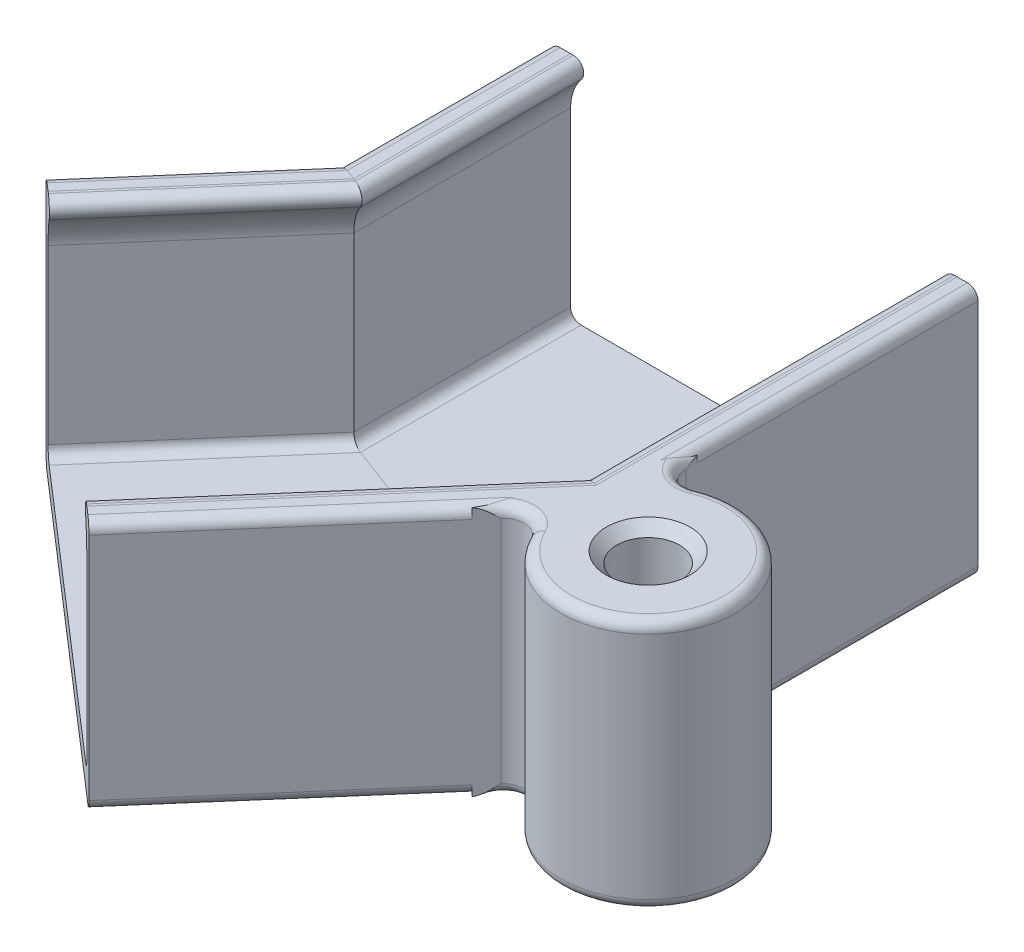
from build123d import *
from OCP.BRepFilletAPI import BRepFilletAPI_MakeChamfer

# Parameters (mm, degrees)
SKETCH4_R           = 3
BOSS_EXTRUDE2_DEPTH = 24
CUT_EXTRUDE2_DEPTH  = 6
CUT_EXTRUDE2_DRAFT  = -2
CHAMFER1_SIZE       = 1
CHAMFER1_SIZE2      = 1.036815955
FILLET2_R           = 1
FILLET3_R           = 1
CHAMFER2_SIZE       = 1


with BuildPart() as part:
    # Sweep1: sweep along a path in Sketch3
    with BuildLine(Plane(origin=(0, 0, 0), x_dir=(1, 0, 0), z_dir=(0, 1, 0))) as sweep1_path:
        Line((0, 0), (0, -27.651449467))
        Line((0, -27.651449467), (-18.11741187, -48.540730085))
    # Sketch1 → Sweep1 (sweep)
    with BuildSketch(Plane.XY):
        with BuildLine():
            Line((-17.5, -12.023018516), (17.5, -12.023018516))
            ThreePointArc((17.5, -12.023018516), (18.207106781, -11.730125297), (18.5, -11.023018516))
            Line((18.5, -11.023018516), (18.5, 5.476981484))
            ThreePointArc((18.5, 5.476981484), (18.235010721, 6.998390104), (17.471251471, 8.340617848))
            ThreePointArc((17.471251471, 8.340617848), (17.338106653, 9.403382917), (18.242640687, 9.976981484))
            Line((18.242640687, 9.976981484), (18.5, 9.976981484))
            Line((18.5, 9.976981484), (19.5, 9.976981484))
            ThreePointArc((19.5, 9.976981484), (20.207106781, 9.684088265), (20.5, 8.976981484))
            Line((20.5, 8.976981484), (20.5, -13.023018516))
            ThreePointArc((20.5, -13.023018516), (20.207106781, -13.730125297), (19.5, -14.023018516))
            Line((19.5, -14.023018516), (-19.5, -14.023018516))
            ThreePointArc((-19.5, -14.023018516), (-20.207106781, -13.730125297), (-20.5, -13.023018516))
            Line((-20.5, -13.023018516), (-20.5, 8.976981484))
            ThreePointArc((-20.5, 8.976981484), (-20.207106781, 9.684088265), (-19.5, 9.976981484))
            Line((-19.5, 9.976981484), (-18.5, 9.976981484))
            Line((-18.5, 9.976981484), (-18.242640687, 9.976981484))
            ThreePointArc((-18.242640687, 9.976981484), (-17.338106653, 9.403382917), (-17.471251471, 8.340617848))
            ThreePointArc((-17.471251471, 8.340617848), (-18.235010721, 6.998390104), (-18.5, 5.476981484))
            Line((-18.5, 5.476981484), (-18.5, -11.023018516))
            ThreePointArc((-18.5, -11.023018516), (-18.207106781, -11.730125297), (-17.5, -12.023018516))
        make_face()
    sweep(path=sweep1_path.line, transition=Transition.RIGHT)

    # Sketch4 → Boss-Extrude2 (add, through all)
    with BuildSketch(Plane(origin=(0, -14.023018516, 0), x_dir=(-1, 0, 0), z_dir=(0, -1, 0))):
        with BuildLine():
            Line((-20.5, -27.966087618), (-20.5, -26.908421005))
            Line((-20.5, -26.908421005), (-19.5, -29.43643253))
            Line((-19.5, -29.43643253), (-19.5, -34.929657496))
            Line((-19.5, -34.929657496), (-15.504976059, -39.535899093))
            Line((-15.504976059, -39.535899093), (-14.394999659, -42.341932225))
            Line((-14.394999659, -42.341932225), (-15.692872888, -40.845491216))
            ThreePointArc((-15.692872888, -40.845491216), (-17.453136797, -40.171510936), (-18.991916583, -41.260058232))
            ThreePointArc((-18.991916583, -41.260058232), (-34.264928426, -40.440540605), (-23.263888778, -29.814458234))
            ThreePointArc((-23.263888778, -29.814458234), (-21.388194612, -29.628582363), (-20.5, -27.966087618))
        make_face()
        with Locations(Location((-26.449921847, -37.523656316, 0), (0, 0, 90))):
            Circle(SKETCH4_R, mode=Mode.SUBTRACT)
    extrude(amount=-BOSS_EXTRUDE2_DEPTH)


with BuildPart() as cut_extrude2_tool:
    # Sketch5 → Cut-Extrude2 (with draft: the straight prism first)
    with BuildSketch(Plane(origin=(0, -14.023018516, 0), x_dir=(-1, 0, 0), z_dir=(0, -1, 0))):
        Polygon((-27.501650461, -43.786818477), (-21.551728614, -41.566061095), (-20.5, -35.302898934), (-25.398193232, -31.260494155), (-31.348115079, -33.481251538), (-32.399843693, -39.744413699), align=None)
    extrude(amount=-CUT_EXTRUDE2_DEPTH)
    # Cut-Extrude2: the draft: its side faces are tilted about the plane it starts from
    cut_extrude2_sides = [cut_extrude2_tool.faces().sort_by_distance(p)[0] for p in [
        (24.526689538, -11.023018516, 42.676439786),
        (21.025864307, -11.023018516, 38.434480014),
        (22.949096616, -11.023018516, 33.281696545),
        (28.373154156, -11.023018516, 32.370872847),
        (31.873979386, -11.023018516, 36.612832618),
        (29.950747077, -11.023018516, 41.765616088),
    ]]
    draft(cut_extrude2_sides, Plane(origin=(0, -14.023018516, 0), x_dir=(-1, 0, 0), z_dir=(0, -1, 0)), CUT_EXTRUDE2_DRAFT)


with BuildPart() as part_1:
    add(part.part)

    # Cut-Extrude2: cut by cut_extrude2_tool
    add(cut_extrude2_tool.part, mode=Mode.SUBTRACT)

    # Chamfer1: one chamfer whose edges measure the first distance from different faces: ONE call of the kernel's chamfer builder (chamfer() names one face for all edges)
    chamfer1_edges_1 = [part_1.edges().sort_by_distance(p)[0] for p in [
        (31.667347826, -8.023018516, 36.647530798),
    ]]
    chamfer1_side_1 = [part_1.faces().sort_by_distance(p)[0] for p in [
        (31.771332319, -11.042436068, 36.630069416),
    ]]
    chamfer1_edges_2 = [part_1.edges().sort_by_distance(p)[0] for p in [
        (28.29988788, -8.023018516, 32.567170116),
    ]]
    chamfer1_side_2 = [part_1.faces().sort_by_distance(p)[0] for p in [
        (28.336758127, -11.042436068, 32.468386213),
    ]]
    chamfer1_edges_3 = [part_1.edges().sort_by_distance(p)[0] for p in [
        (23.082461901, -8.023018516, 33.443295635),
    ]]
    chamfer1_side_3 = [part_1.faces().sort_by_distance(p)[0] for p in [
        (23.015347654, -11.042436068, 33.361973113),
    ]]
    chamfer1_edges_4 = [part_1.edges().sort_by_distance(p)[0] for p in [
        (21.232495867, -8.023018516, 38.399781835),
    ]]
    chamfer1_side_4 = [part_1.faces().sort_by_distance(p)[0] for p in [
        (21.128511374, -11.042436068, 38.417243217),
    ]]
    chamfer1_edges_5 = [part_1.edges().sort_by_distance(p)[0] for p in [
        (24.599955813, -8.023018516, 42.480142516),
    ]]
    chamfer1_side_5 = [part_1.faces().sort_by_distance(p)[0] for p in [
        (24.563085567, -11.042436068, 42.57892642),
    ]]
    chamfer1_edges_6 = [part_1.edges().sort_by_distance(p)[0] for p in [
        (29.817381793, -8.023018516, 41.604016998),
    ]]
    chamfer1_side_6 = [part_1.faces().sort_by_distance(p)[0] for p in [
        (29.884496039, -11.042436068, 41.685339519),
    ]]
    chamfer1 = BRepFilletAPI_MakeChamfer(part_1.part.solid().wrapped)
    for e in chamfer1_edges_1:
        chamfer1.Add(CHAMFER1_SIZE, CHAMFER1_SIZE2, e.wrapped, chamfer1_side_1[0].wrapped)  # the first distance lies on this face
    for e in chamfer1_edges_2:
        chamfer1.Add(CHAMFER1_SIZE, CHAMFER1_SIZE2, e.wrapped, chamfer1_side_2[0].wrapped)  # the first distance lies on this face
    for e in chamfer1_edges_3:
        chamfer1.Add(CHAMFER1_SIZE, CHAMFER1_SIZE2, e.wrapped, chamfer1_side_3[0].wrapped)  # the first distance lies on this face
    for e in chamfer1_edges_4:
        chamfer1.Add(CHAMFER1_SIZE, CHAMFER1_SIZE2, e.wrapped, chamfer1_side_4[0].wrapped)  # the first distance lies on this face
    for e in chamfer1_edges_5:
        chamfer1.Add(CHAMFER1_SIZE, CHAMFER1_SIZE2, e.wrapped, chamfer1_side_5[0].wrapped)  # the first distance lies on this face
    for e in chamfer1_edges_6:
        chamfer1.Add(CHAMFER1_SIZE, CHAMFER1_SIZE2, e.wrapped, chamfer1_side_6[0].wrapped)  # the first distance lies on this face
    add(Compound.cast(chamfer1.Shape()), mode=Mode.REPLACE)

    # Fillet2
    # the kernel refuses this fillet: 1 mm, written as the material it takes off along each edge
    with BuildSketch(Plane(origin=(22.5, 9.976981484, 27.966087618), x_dir=(0.3819443891792231, 0, 0.9241853080278383), z_dir=(0.9241853080278383, 0, -0.3819443891792231))) as fillet2_piece_1:
        with BuildLine():
            CenterArc((2 + FILLET2_R, FILLET2_R), FILLET2_R, 180, 90)
            Line((2 + FILLET2_R, 0), (2, 0))
            Line((2, 0), (2, FILLET2_R))
        make_face()
    revolve(axis=Axis((22.5, 9.976981484, 27.966087618), (0, -1, 0)), revolution_arc=184.118823056, mode=Mode.SUBTRACT)
    with BuildSketch(Plane(origin=(17.20377239, 9.976981484, 42.155904393), x_dir=(-0.859590792427854, 0, 0.5109830423539063), z_dir=(0.5109830423539063, 0, 0.859590792427854))) as fillet2_piece_2:
        with BuildLine():
            CenterArc((2 + FILLET2_R, FILLET2_R), FILLET2_R, 180, 90)
            Line((2 + FILLET2_R, 0), (2, 0))
            Line((2, 0), (2, FILLET2_R))
        make_face()
    revolve(axis=Axis((17.20377239, 9.976981484, 42.155904393), (0, -1, 0)), revolution_arc=184.118823056, mode=Mode.SUBTRACT)
    with BuildSketch(Plane(origin=(26.449921847, 9.976981484, 37.523656316), x_dir=(-0.8940720964908391, 0, 0.44792308075882376), z_dir=(-0.44792308075882376, 0, -0.8940720964908391))) as fillet2_piece_3:
        with BuildLine():
            CenterArc((8.341615059 - FILLET2_R, -FILLET2_R), FILLET2_R, 0, 90)
            Line((8.341615059 - FILLET2_R, 0), (8.341615059, 0))
            Line((8.341615059, 0), (8.341615059, -FILLET2_R))
        make_face()
    revolve(axis=Axis((26.449921847, 9.976981484, 37.523656316), (0, 1, 0)), revolution_arc=265.843665859, mode=Mode.SUBTRACT)

    # Fillet3
    # the kernel refuses this fillet: 1 mm, written as the material it takes off along each edge
    with BuildSketch(Plane(origin=(22.5, -14.023018516, 27.966087618), x_dir=(0.3819443891792231, 0, 0.9241853080278383), z_dir=(0.9241853080278383, 0, -0.3819443891792231))) as fillet3_piece_1:
        with BuildLine():
            CenterArc((2 + FILLET3_R, -FILLET3_R), FILLET3_R, 90, 90)
            Line((2, -FILLET3_R), (2, 0))
            Line((2, 0), (2 + FILLET3_R, 0))
        make_face()
    revolve(axis=Axis((22.5, -14.023018516, 27.966087618), (0, -1, 0)), revolution_arc=184.118823056, mode=Mode.SUBTRACT)
    with BuildSketch(Plane(origin=(17.20377239, -14.023018516, 42.155904393), x_dir=(-0.859590792427854, 0, 0.5109830423539063), z_dir=(0.5109830423539063, 0, 0.859590792427854))) as fillet3_piece_2:
        with BuildLine():
            CenterArc((2 + FILLET3_R, -FILLET3_R), FILLET3_R, 90, 90)
            Line((2, -FILLET3_R), (2, 0))
            Line((2, 0), (2 + FILLET3_R, 0))
        make_face()
    revolve(axis=Axis((17.20377239, -14.023018516, 42.155904393), (0, -1, 0)), revolution_arc=184.118823056, mode=Mode.SUBTRACT)
    with BuildSketch(Plane(origin=(26.449921847, -14.023018516, 37.523656316), x_dir=(-0.8940720964908391, 0, 0.44792308075882376), z_dir=(-0.44792308075882376, 0, -0.8940720964908391))) as fillet3_piece_3:
        with BuildLine():
            CenterArc((8.341615059 - FILLET3_R, FILLET3_R), FILLET3_R, 270, 90)
            Line((8.341615059, FILLET3_R), (8.341615059, 0))
            Line((8.341615059, 0), (8.341615059 - FILLET3_R, 0))
        make_face()
    revolve(axis=Axis((26.449921847, -14.023018516, 37.523656316), (0, 1, 0)), revolution_arc=265.843665859, mode=Mode.SUBTRACT)

    # Chamfer2
    chamfer2_edges = [part_1.edges().sort_by_distance(p)[0] for p in [
        (26.449921847, 9.976981484, 40.523656316),
    ]]
    chamfer(chamfer2_edges, length=CHAMFER2_SIZE)


solid = part_1.part
